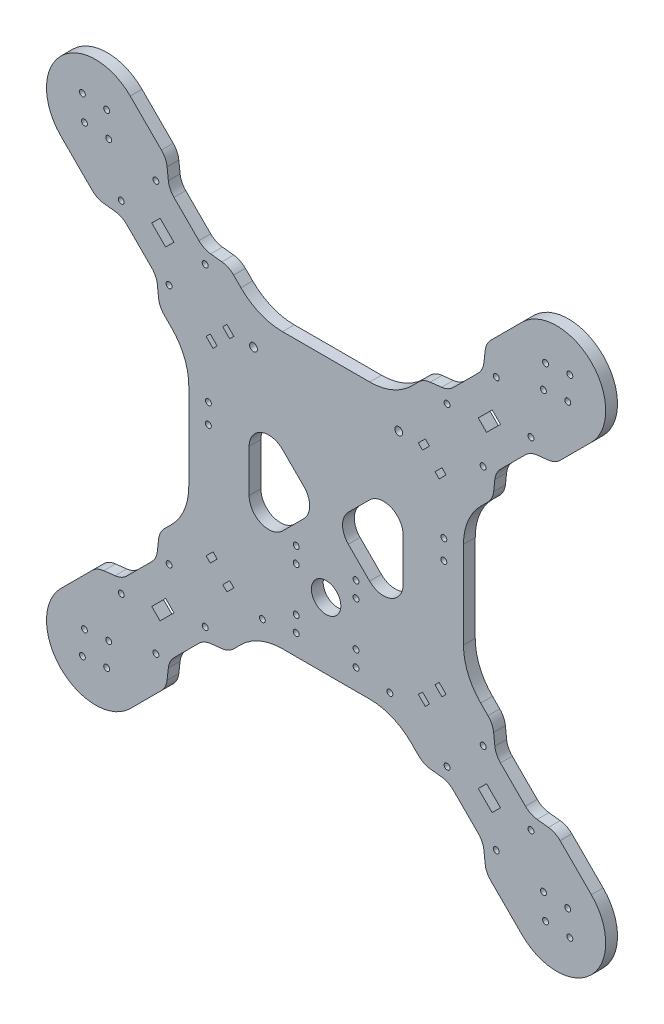
from build123d import *

# Parameters (mm, degrees)
BOSS_EXTRUDE1_DEPTH      = 6
FILLET1_R                = 30
SKETCH8_R                = 1.5
CUT_EXTRUDE1_DEPTH       = 202.614731605
SKETCH9_R                = 1.5
CUT_EXTRUDE2_DEPTH       = 202.614731605
MIRROR2_COPY_1_SKETCH_R  = 1.5
MIRROR2_COPY_1_DEPTH     = 202.614731605
MIRROR2_COPY_2_SKETCH_R  = 1.5
MIRROR2_COPY_2_DEPTH     = 202.614731605
MIRROR2_COPY_3_SKETCH_R  = 1.5
MIRROR2_COPY_3_DEPTH     = 202.614731605
MIRROR2_COPY_4_SKETCH_R  = 1.5
MIRROR2_COPY_4_DEPTH     = 202.614731605
CUT_EXTRUDE3_DEPTH       = 202.614731605
CUT_EXTRUDE3_DEPTH_BACK  = 202.614731605
SKETCH10_R               = 1.5
SKETCH10_R_2             = 1.499999999
SKETCH10_R_3             = 7.5
SKETCH10_R_4             = 2
FILLET2_R                = 10
CUT_EXTRUDE4_DEPTH       = 202.614731605
CIRPATTERN2_COUNT        = 4
CIRPATTERN2_COPY_1_DEPTH = 202.614731605
CIRPATTERN2_COPY_2_DEPTH = 202.614731605
CIRPATTERN2_COPY_3_DEPTH = 202.614731605
FILLET3_R                = 10


with BuildPart() as part:
    # Sketch4 → Boss-Extrude1 (new body)
    with BuildSketch(Plane.XY):
        with BuildLine():
            Line((-70, -34.644660941), (-70, 34.644660941))
            Line((-70, 34.644660941), (-135.17766953, 99.82233047))
            ThreePointArc((-135.17766953, 99.82233047), (-135.17766953, 135.17766953), (-99.82233047, 135.17766953))
            Line((-99.82233047, 135.17766953), (-34.644660941, 70))
            Line((-34.644660941, 70), (34.644660941, 70))
            Line((34.644660941, 70), (99.82233047, 135.17766953))
            ThreePointArc((99.82233047, 135.17766953), (135.17766953, 135.17766953), (135.17766953, 99.82233047))
            Line((135.17766953, 99.82233047), (70, 34.644660941))
            Line((70, 34.644660941), (70, -34.644660941))
            Line((70, -34.644660941), (135.17766953, -99.82233047))
            ThreePointArc((135.17766953, -99.82233047), (135.17766953, -135.17766953), (99.82233047, -135.17766953))
            Line((99.82233047, -135.17766953), (34.644660941, -70))
            Line((34.644660941, -70), (-34.644660941, -70))
            Line((-34.644660941, -70), (-99.82233047, -135.17766953))
            ThreePointArc((-99.82233047, -135.17766953), (-135.17766953, -135.17766953), (-135.17766953, -99.82233047))
            Line((-135.17766953, -99.82233047), (-70, -34.644660941))
        make_face()
    extrude(amount=BOSS_EXTRUDE1_DEPTH)

    # Fillet1
    fillet1_edges = [part.edges().sort_by_distance(p)[0] for p in [
        (34.644660941, -70, 3),
        (70, -34.644660941, 3),
        (70, 34.644660941, 3),
        (34.644660941, 70, 3),
        (-34.644660941, 70, 3),
        (-70, 34.644660941, 3),
        (-70, -34.644660941, 3),
        (-34.644660941, -70, 3),
    ]]
    fillet(fillet1_edges, radius=FILLET1_R)

    # Sketch8 → Cut-Extrude1 (cut, symmetric)
    with BuildSketch(Plane.XY.offset(6)):
        with Locations((-104.418524548, 86.740855018)):
            Circle(SKETCH8_R)
        with Locations((-80.023340597, 61.638564286)):
            Circle(SKETCH8_R)
        with Locations((-86.740855018, 104.418524548)):
            Circle(SKETCH8_R)
        with Locations((-61.638564286, 80.023340597)):
            Circle(SKETCH8_R)
        Polygon((-88.862175362, 84.619534675), (-84.619534675, 88.862175362), (-77.548466863, 81.79110755), (-81.79110755, 77.548466863), align=None)
    cut_extrude1 = extrude(amount=CUT_EXTRUDE1_DEPTH, both=True, mode=Mode.SUBTRACT)

    # Sketch9 → Cut-Extrude2 (cut, symmetric)
    with BuildSketch(Plane.XY.offset(6)):
        with Locations((-124.217514421, 124.217514421)):
            Circle(SKETCH9_R)
        with Locations((-110.782485579, 110.782485579)):
            Circle(SKETCH9_R)
        with Locations((-123.156854249, 111.843145751)):
            Circle(SKETCH9_R)
        with Locations((-111.843145751, 123.156854249)):
            Circle(SKETCH9_R)
    cut_extrude2 = extrude(amount=CUT_EXTRUDE2_DEPTH, both=True, mode=Mode.SUBTRACT)

    # Mirror1: Cut-Extrude1, Cut-Extrude2 across plane
    add(cut_extrude1.mirror(Plane(origin=(0, 0, 0), x_dir=(0, 0, 1), z_dir=(1, 0, 0))), mode=Mode.SUBTRACT)
    add(cut_extrude2.mirror(Plane(origin=(0, 0, 0), x_dir=(0, 0, 1), z_dir=(1, 0, 0))), mode=Mode.SUBTRACT)

    # Mirror2 copy 1 sketch → Mirror2 copy 1 (cut, symmetric)
    with BuildSketch(Plane(origin=(0, 0, 6), x_dir=(-1, 0, 0), z_dir=(0, 0, 1))):
        with Locations((-104.418524548, 86.740855018)):
            Circle(MIRROR2_COPY_1_SKETCH_R)
        with Locations((-80.023340597, 61.638564286)):
            Circle(MIRROR2_COPY_1_SKETCH_R)
        with Locations((-86.740855018, 104.418524548)):
            Circle(MIRROR2_COPY_1_SKETCH_R)
        with Locations((-61.638564286, 80.023340597)):
            Circle(MIRROR2_COPY_1_SKETCH_R)
        Polygon((-88.862175362, 84.619534675), (-84.619534675, 88.862175362), (-77.548466863, 81.79110755), (-81.79110755, 77.548466863), align=None)
    extrude(amount=MIRROR2_COPY_1_DEPTH, both=True, mode=Mode.SUBTRACT)

    # Mirror2 copy 2 sketch → Mirror2 copy 2 (cut, symmetric)
    with BuildSketch(Plane(origin=(0, 0, 6), x_dir=(-1, 0, 0), z_dir=(0, 0, 1))):
        with Locations((-124.217514421, 124.217514421)):
            Circle(MIRROR2_COPY_2_SKETCH_R)
        with Locations((-110.782485579, 110.782485579)):
            Circle(MIRROR2_COPY_2_SKETCH_R)
        with Locations((-123.156854249, 111.843145751)):
            Circle(MIRROR2_COPY_2_SKETCH_R)
        with Locations((-111.843145751, 123.156854249)):
            Circle(MIRROR2_COPY_2_SKETCH_R)
    extrude(amount=MIRROR2_COPY_2_DEPTH, both=True, mode=Mode.SUBTRACT)

    # Mirror2 copy 3 sketch → Mirror2 copy 3 (cut, symmetric)
    with BuildSketch(Plane.XY.offset(6)):
        with Locations((-104.418524548, -86.740855018)):
            Circle(MIRROR2_COPY_3_SKETCH_R)
        with Locations((-80.023340597, -61.638564286)):
            Circle(MIRROR2_COPY_3_SKETCH_R)
        with Locations((-86.740855018, -104.418524548)):
            Circle(MIRROR2_COPY_3_SKETCH_R)
        with Locations((-61.638564286, -80.023340597)):
            Circle(MIRROR2_COPY_3_SKETCH_R)
        Polygon((-88.862175362, -84.619534675), (-84.619534675, -88.862175362), (-77.548466863, -81.79110755), (-81.79110755, -77.548466863), align=None)
    extrude(amount=MIRROR2_COPY_3_DEPTH, both=True, mode=Mode.SUBTRACT)

    # Mirror2 copy 4 sketch → Mirror2 copy 4 (cut, symmetric)
    with BuildSketch(Plane.XY.offset(6)):
        with Locations((-124.217514421, -124.217514421)):
            Circle(MIRROR2_COPY_4_SKETCH_R)
        with Locations((-110.782485579, -110.782485579)):
            Circle(MIRROR2_COPY_4_SKETCH_R)
        with Locations((-123.156854249, -111.843145751)):
            Circle(MIRROR2_COPY_4_SKETCH_R)
        with Locations((-111.843145751, -123.156854249)):
            Circle(MIRROR2_COPY_4_SKETCH_R)
    extrude(amount=MIRROR2_COPY_4_DEPTH, both=True, mode=Mode.SUBTRACT)

    # Sketch10 → Cut-Extrude3 (cut, two sides: drawn at the far end of the back side and taken through both)
    with BuildSketch(Plane.XY.offset(6).offset(-CUT_EXTRUDE3_DEPTH_BACK)):
        with Locations((-60, 20)):
            Circle(SKETCH10_R)
        with Locations((-60, 10)):
            Circle(SKETCH10_R)
        with Locations((60, 20)):
            Circle(SKETCH10_R)
        with Locations((60, 10)):
            Circle(SKETCH10_R)
        with Locations((-15.249999999, -21)):
            Circle(SKETCH10_R_2)
        with Locations((15.249999999, -21)):
            Circle(SKETCH10_R)
        with Locations((-15.249999999, -51.5)):
            Circle(SKETCH10_R_2)
        with Locations((15.249999999, -51.5)):
            Circle(SKETCH10_R)
        with Locations((0, -36.249999999)):
            Circle(SKETCH10_R_3)
        with Locations((-37, 55.742640687)):
            Circle(SKETCH10_R_4)
        with Locations((37, 55.742640687)):
            Circle(SKETCH10_R_4)
        with Locations((32.5, -62)):
            Circle(SKETCH10_R)
        with Locations((-32.5, -62)):
            Circle(SKETCH10_R)
        with Locations((15.250000001, -29)):
            Circle(SKETCH10_R)
        with Locations((-15.249999999, -29)):
            Circle(SKETCH10_R)
        with Locations((15.250000001, -59.5)):
            Circle(SKETCH10_R)
        with Locations((-15.249999999, -59.5)):
            Circle(SKETCH10_R_2)
        Polygon((-49.142135624, -53.384776311), (-47.02081528, -55.506096654), (-50.556349186, -59.04163056), (-52.67766953, -56.920310217), align=None)
        Polygon((-4.242640687, 0), (-39.242640687, 35), (-39.242640687, -35), align=None)
        Polygon((39.242640687, 35), (39.242640687, -35), (4.242640687, 0), align=None)
        Polygon((-57.627416998, -44.899494937), (-55.506096654, -47.02081528), (-59.04163056, -50.556349186), (-61.162950904, -48.435028843), align=None)
        Polygon((-61.162950904, 48.435028843), (-59.04163056, 50.556349186), (-55.506096654, 47.02081528), (-57.627416998, 44.899494937), align=None)
        Polygon((57.627416998, 44.899494937), (55.506096654, 47.02081528), (59.04163056, 50.556349186), (61.162950904, 48.435028843), align=None)
        Polygon((61.162950904, -48.435028843), (57.627416998, -44.899494937), (55.506096654, -47.02081528), (59.04163056, -50.556349186), align=None)
        Polygon((-52.67766953, 56.920310217), (-50.556349186, 59.04163056), (-47.02081528, 55.506096654), (-49.142135624, 53.384776311), align=None)
        Polygon((52.67766953, -56.920310217), (49.142135624, -53.384776311), (47.02081528, -55.506096654), (50.556349186, -59.04163056), align=None)
        Polygon((49.142135624, 53.384776311), (47.02081528, 55.506096654), (50.556349186, 59.04163056), (52.67766953, 56.920310217), align=None)
    extrude(amount=CUT_EXTRUDE3_DEPTH + CUT_EXTRUDE3_DEPTH_BACK, mode=Mode.SUBTRACT)

    # Fillet2
    fillet2_edges = [part.edges().sort_by_distance(p)[0] for p in [
        (4.242640687, 0, 3),
        (39.242640687, -35, 3),
        (39.242640687, 35, 3),
        (-39.242640687, -35, 3),
        (-39.242640687, 35, 3),
        (-4.242640687, 0, 3),
    ]]
    fillet(fillet2_edges, radius=FILLET2_R)

    # Sketch11 → Cut-Extrude4 (cut, symmetric)
    with BuildSketch(Plane.XY.offset(6)):
        Polygon((-80.023340597, 104.064971157), (-62.345671067, 86.387301628), (-49.617749006, 84.973088065), (-81.437554159, 116.792893219), align=None)
    cut_extrude4 = extrude(amount=CUT_EXTRUDE4_DEPTH, both=True, mode=Mode.SUBTRACT)

    # Mirror4: Cut-Extrude4 across plane
    add(cut_extrude4.mirror(Plane(origin=(0, 0, 0), x_dir=(0, 0, 1), z_dir=(0.7071067811865474, 0.7071067811865477, 0))), mode=Mode.SUBTRACT)

    # CirPattern2: Cut-Extrude4 ×4 about axis
    cirpattern2_axis = Axis((0, 0, 0), (0, 0, 1))
    for i in range(1, CIRPATTERN2_COUNT):
        add(cut_extrude4.rotate(cirpattern2_axis, i * 360 / CIRPATTERN2_COUNT), mode=Mode.SUBTRACT)

    # CirPattern2 copy 1 sketch → CirPattern2 copy 1 (cut, symmetric)
    with BuildSketch(Plane.XY.offset(6)):
        Polygon((-80.023340597, -104.064971157), (-62.345671067, -86.387301628), (-49.617749006, -84.973088065), (-81.437554159, -116.792893219), align=None)
    extrude(amount=CIRPATTERN2_COPY_1_DEPTH, both=True, mode=Mode.SUBTRACT)

    # CirPattern2 copy 2 sketch → CirPattern2 copy 2 (cut, symmetric)
    with BuildSketch(Plane(origin=(0, 0, 6), x_dir=(0, 1, 0), z_dir=(0, 0, 1))):
        Polygon((-80.023340597, -104.064971157), (-62.345671067, -86.387301628), (-49.617749006, -84.973088065), (-81.437554159, -116.792893219), align=None)
    extrude(amount=CIRPATTERN2_COPY_2_DEPTH, both=True, mode=Mode.SUBTRACT)

    # CirPattern2 copy 3 sketch → CirPattern2 copy 3 (cut, symmetric)
    with BuildSketch(Plane(origin=(0, 0, 6), x_dir=(-1, 0, 0), z_dir=(0, 0, 1))):
        Polygon((-80.023340597, -104.064971157), (-62.345671067, -86.387301628), (-49.617749006, -84.973088065), (-81.437554159, -116.792893219), align=None)
    extrude(amount=CIRPATTERN2_COPY_3_DEPTH, both=True, mode=Mode.SUBTRACT)

    # Fillet3
    fillet3_edges = [part.edges().sort_by_distance(p)[0] for p in [
        (-49.617749006, 84.973088065, 3),
        (-62.345671067, 86.387301628, 3),
        (-80.023340597, 104.064971157, 3),
        (-81.437554159, 116.792893219, 3),
        (116.792893219, 81.437554159, 3),
        (104.064971157, 80.023340597, 3),
        (86.387301628, 62.345671067, 3),
        (84.973088065, 49.617749006, 3),
        (80.023340597, 104.064971157, 3),
        (81.437554159, 116.792893219, 3),
        (62.345671067, 86.387301628, 3),
        (49.617749006, 84.973088065, 3),
        (116.792893219, -81.437554159, 3),
        (104.064971157, -80.023340597, 3),
        (86.387301628, -62.345671067, 3),
        (84.973088065, -49.617749006, 3),
        (81.437554159, -116.792893219, 3),
        (80.023340597, -104.064971157, 3),
        (62.345671067, -86.387301628, 3),
        (49.617749006, -84.973088065, 3),
        (-49.617749006, -84.973088065, 3),
        (-62.345671067, -86.387301628, 3),
        (-80.023340597, -104.064971157, 3),
        (-81.437554159, -116.792893219, 3),
        (-116.792893219, -81.437554159, 3),
        (-104.064971157, -80.023340597, 3),
        (-86.387301628, -62.345671067, 3),
        (-84.973088065, -49.617749006, 3),
        (-84.973088065, 49.617749006, 3),
        (-86.387301628, 62.345671067, 3),
        (-104.064971157, 80.023340597, 3),
        (-116.792893219, 81.437554159, 3),
    ]]
    fillet(fillet3_edges, radius=FILLET3_R)


solid = part.part
